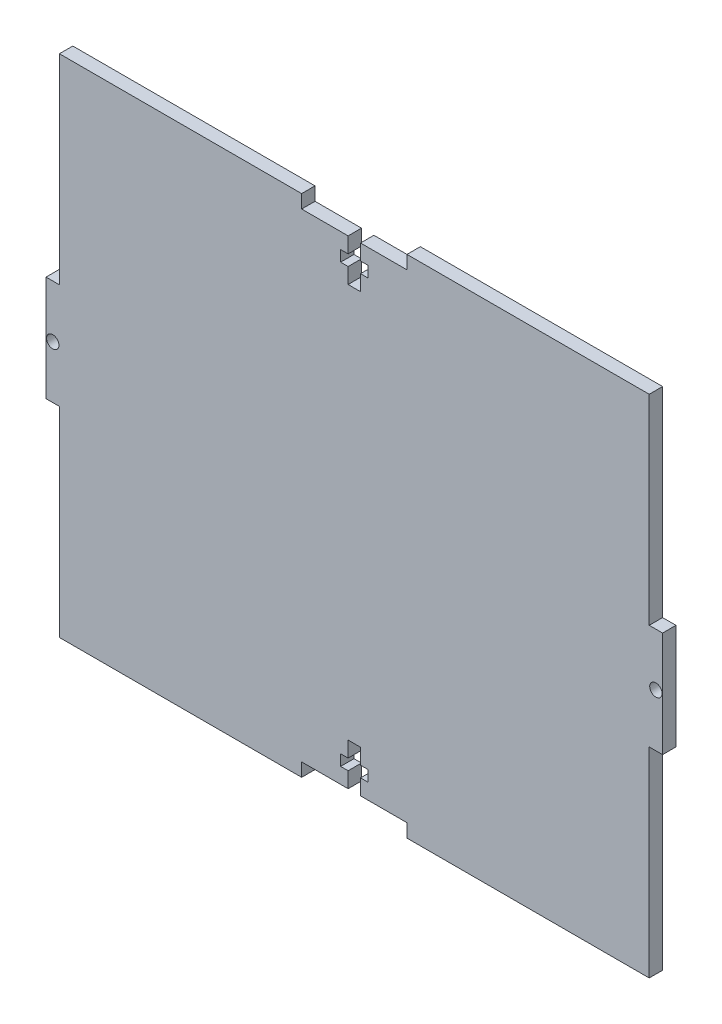
from build123d import *

# Parameters (mm, degrees)
SKETCH1_R           = 1.47
BOSS_EXTRUDE1_DEPTH = 1.5875


with BuildPart() as part:
    # Sketch1 → Boss-Extrude1 (new, symmetric)
    with BuildSketch(Plane.XY):
        Polygon((-12.5, 60), (-70, 60), (-70, 12.5), (-73.175, 12.5), (-73.175, -12.5), (-70, -12.5), (-70, -60), (-12.5, -60), (-12.5, -56.825), (-1.47, -56.825), (-1.47, -53.125), (-3.25, -53.125), (-3.25, -50.525), (-1.47, -50.525), (-1.47, -46.825), (1.47, -46.825), (1.47, -50.525), (3.25, -50.525), (3.25, -53.125), (1.47, -53.125), (1.47, -56.825), (12.5, -56.825), (12.5, -60), (70, -60), (70, -12.5), (73.175, -12.5), (73.175, 12.5), (70, 12.5), (70, 60), (12.5, 60), (12.5, 56.825), (1.47, 56.825), (1.47, 53.125), (3.25, 53.125), (3.25, 50.525), (1.47, 50.525), (1.47, 46.825), (-1.47, 46.825), (-1.47, 50.525), (-3.25, 50.525), (-3.25, 53.125), (-1.47, 53.125), (-1.47, 56.825), (-12.5, 56.825), align=None)
        with Locations((71.5875, 0)):
            Circle(SKETCH1_R, mode=Mode.SUBTRACT)
        with Locations((-71.5875, 0)):
            Circle(SKETCH1_R, mode=Mode.SUBTRACT)
    extrude(amount=BOSS_EXTRUDE1_DEPTH, both=True)


solid = part.part
